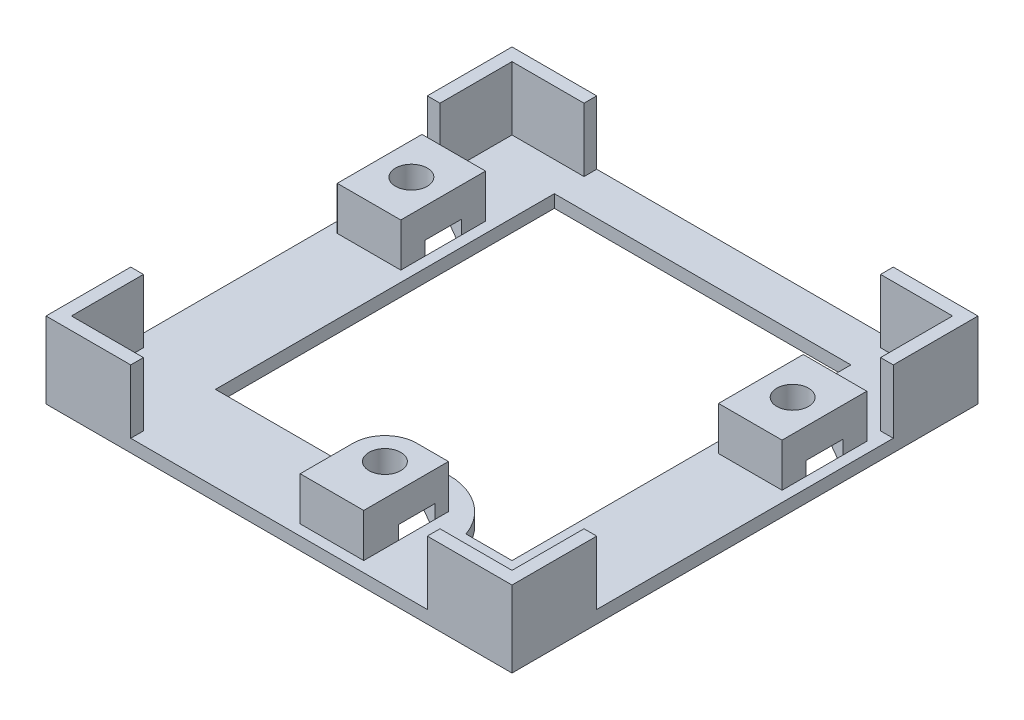
from build123d import *

# Parameters (mm, degrees)
SKETCH1_W           = 44
SKETCH1_H           = 44
SKETCH1_R           = 1.5
BOSS_EXTRUDE1_DEPTH = 1.2
BOSS_EXTRUDE4_DEPTH = 6
SKETCH5_W           = 6
SKETCH5_H           = 8
BOSS_EXTRUDE8_DEPTH = 4.1
SKETCH1_3_R         = 1.5
CUT_EXTRUDE1_DEPTH  = 2.5
SKETCH1_4_R         = 1.5
CUT_EXTRUDE2_DEPTH  = 63.640561939


with BuildPart() as part:
    # Sketch1 → Boss-Extrude1 (new body)
    with BuildSketch(Plane(origin=(0, 0, 0), x_dir=(1, 0, 0), z_dir=(0, 1, 0))):
        with Locations((22, 22)):
            Rectangle(SKETCH1_W, SKETCH1_H)
        with BuildLine():
            Line((36, 8), (31.656854249, 8))
            ThreePointArc((31.656854249, 8), (26, 12), (20.343145751, 8))
            Line((20.343145751, 8), (8, 8))
            Line((8, 8), (8, 40))
            Line((8, 40), (36, 40))
            Line((36, 40), (36, 8))
        make_face(mode=Mode.SUBTRACT)
        with Locations((26, 6)):
            Circle(SKETCH1_R, mode=Mode.SUBTRACT)
        with Locations((4, 30.5)):
            Circle(SKETCH1_R, mode=Mode.SUBTRACT)
        with Locations((40, 30.5)):
            Circle(SKETCH1_R, mode=Mode.SUBTRACT)
    extrude(amount=BOSS_EXTRUDE1_DEPTH)

    # Sketch4 → Boss-Extrude4 (add)
    with BuildSketch(Plane(origin=(0, 1.2, 0), x_dir=(1, 0, 0), z_dir=(0, 1, 0))):
        Polygon((8, 44), (0, 44), (0, 36), (1.2, 36), (1.2, 42.8), (8, 42.8), align=None)
        Polygon((44, 44), (36, 44), (36, 42.8), (42.8, 42.8), (42.8, 36), (44, 36), align=None)
        Polygon((1.2, 8), (0, 8), (0, 0), (8, 0), (8, 1.2), (1.2, 1.2), align=None)
        Polygon((44, 8), (42.8, 8), (42.8, 1.2), (36, 1.2), (36, 0), (44, 0), align=None)
    extrude(amount=BOSS_EXTRUDE4_DEPTH)

    # Sketch5 → Boss-Extrude8 (add)
    with BuildSketch(Plane(origin=(0, 1.2, 0), x_dir=(1, 0, 0), z_dir=(0, 1, 0))):
        with Locations((4, 30.5)):
            Rectangle(SKETCH5_W, SKETCH5_H)
        with Locations((40, 30.5)):
            Rectangle(SKETCH5_W, SKETCH5_H)
        with BuildLine():
            Line((26, 9), (29, 9))
            Line((29, 9), (29, 1))
            Line((29, 1), (23, 1))
            Line((23, 1), (23, 6))
            ThreePointArc((23, 6), (23.878679656, 8.121320344), (26, 9))
        make_face()
    extrude(amount=BOSS_EXTRUDE8_DEPTH)

    # Sketch1<3> → Cut-Extrude1 (cut)
    # profile 1 of 3: a face of its own
    with BuildSketch(Plane(origin=(0, 0, 0), x_dir=(1, 0, 0), z_dir=(0, 1, 0))):
        Polygon((4, 33.964101615), (1, 32.232050808), (1, 28.767949192), (4, 27.035898385), (7, 28.767949192), (7, 32.232050808), align=None)
        with Locations((4, 30.5)):
            Circle(SKETCH1_3_R, mode=Mode.SUBTRACT)
    # profile 2 of 3: a face of its own
    with BuildSketch(Plane(origin=(0, 0, 0), x_dir=(1, 0, 0), z_dir=(0, 1, 0))):
        Polygon((40, 33.964101615), (37, 32.232050808), (37, 28.767949192), (40, 27.035898385), (43, 28.767949192), (43, 32.232050808), align=None)
        with Locations((40, 30.5)):
            Circle(SKETCH1_3_R, mode=Mode.SUBTRACT)
    # profile 3 of 3: a face of its own
    with BuildSketch(Plane(origin=(0, 0, 0), x_dir=(1, 0, 0), z_dir=(0, 1, 0))):
        Polygon((26, 9.464101615), (23, 7.732050808), (23, 4.267949192), (26, 2.535898385), (29, 4.267949192), (29, 7.732050808), align=None)
        with Locations((26, 6)):
            Circle(SKETCH1_3_R, mode=Mode.SUBTRACT)
    extrude(amount=CUT_EXTRUDE1_DEPTH, mode=Mode.SUBTRACT)

    # Sketch1<4> → Cut-Extrude2 (cut, through all)
    with BuildSketch(Plane(origin=(0, 0, 0), x_dir=(1, 0, 0), z_dir=(0, 1, 0))):
        with Locations((4, 30.5)):
            Circle(SKETCH1_4_R)
        with Locations((40, 30.5)):
            Circle(SKETCH1_4_R)
        with Locations((26, 6)):
            Circle(SKETCH1_4_R)
    extrude(amount=CUT_EXTRUDE2_DEPTH, mode=Mode.SUBTRACT)


solid = part.part
